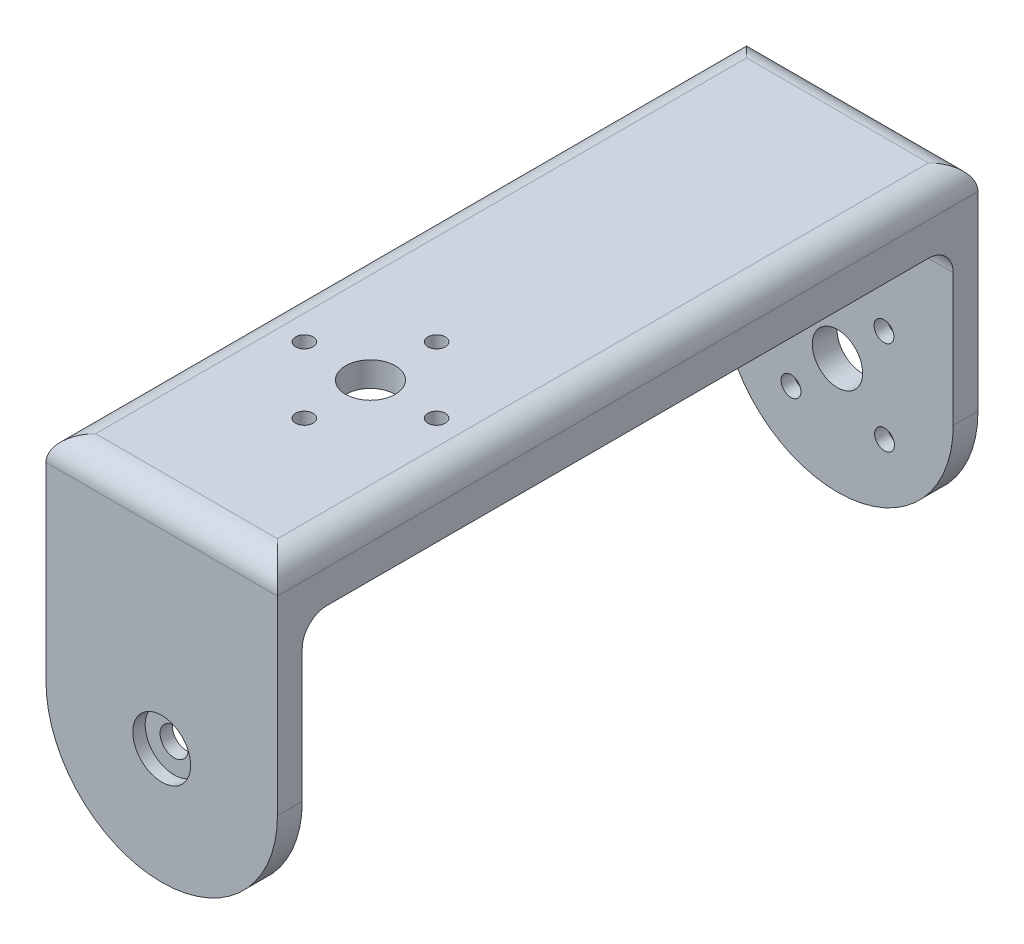
from build123d import *

# Parameters (mm, degrees)
ESBO_O1_R                                            = 3.05
RESSALTO_EXTRUS_O1_DEPTH                             = 3
REBAIXO_PARA_PARAFUSO_COM_CABE_A_REDONDA_D           = 2.4
REBAIXO_PARA_PARAFUSO_COM_CABE_A_REDONDA_CBORE_D     = 4.4
REBAIXO_PARA_PARAFUSO_COM_CABE_A_REDONDA_CBORE_DEPTH = 1.4
PADR_OCIRCULAR1_COUNT                                = 4
SKETCH6_W                                            = 28
SKETCH6_H                                            = 3
BOSS_EXTRUDE2_DEPTH                                  = 78.75
SKETCH8_W                                            = 28
SKETCH8_H                                            = 3
BOSS_EXTRUDE3_DEPTH                                  = 3
SKETCH10_R                                           = 3.05
BOSS_EXTRUDE4_DEPTH                                  = 3
SKETCH12_R                                           = 3.5
CUT_EXTRUDE3_DEPTH                                   = 1.5
SKETCH13_R                                           = 1.7
CUT_EXTRUDE4_DEPTH                                   = 1.5
SKETCH15_R                                           = 1.05
SKETCH15_R_2                                         = 3
CUT_EXTRUDE5_DEPTH                                   = 3
ESBO_O12_W                                           = 84.75
ESBO_O12_H                                           = 7
RESSALTO_EXTRUS_O2_DEPTH                             = 3
ESBO_O13_W                                           = 84.75
ESBO_O13_H                                           = 7
RESSALTO_EXTRUS_O3_DEPTH                             = 3
FILLET2_R                                            = 3


with BuildPart() as part:
    # Esboço1 → Ressalto-extrusão1 (new body)
    with BuildSketch(Plane.XY):
        with BuildLine():
            Line((16.663507, 58.105442), (-7.336493, 58.105442))
            Line((-7.336493, 58.105442), (-9.336493, 58.105442))
            Line((-9.336493, 58.105442), (-9.336493, 32.105442))
            ThreePointArc((-9.336493, 32.105442), (4.663507, 18.105442), (18.663507, 32.105442))
            Line((18.663507, 32.105442), (18.663507, 58.105442))
            Line((18.663507, 58.105442), (16.663507, 58.105442))
        make_face()
        with Locations((4.663507, 32.105442)):
            Circle(ESBO_O1_R, mode=Mode.SUBTRACT)
    ressalto_extrus_o1 = extrude(amount=-RESSALTO_EXTRUS_O1_DEPTH)

    # Rebaixo para parafuso com cabeça redonda de M21 (through all)
    with Locations(Plane(origin=(0, 0, -3), x_dir=(-1, 0, 0), z_dir=(0, 0, -1))):
        with Locations((-10.288249, 37.794227)):
            rebaixo_para_parafuso_com_cabe_a_redonda = CounterBoreHole(REBAIXO_PARA_PARAFUSO_COM_CABE_A_REDONDA_D / 2, REBAIXO_PARA_PARAFUSO_COM_CABE_A_REDONDA_CBORE_D / 2, REBAIXO_PARA_PARAFUSO_COM_CABE_A_REDONDA_CBORE_DEPTH)

    # PadrãoCircular1: Rebaixo para parafuso com cabeça redonda de M21 ×4 about axis
    padr_ocircular1_axis = Axis((4.663507, 32.105442, 0), (0, 0, 1))
    for i in range(1, PADR_OCIRCULAR1_COUNT):
        add(rebaixo_para_parafuso_com_cabe_a_redonda.rotate(padr_ocircular1_axis, i * 360 / PADR_OCIRCULAR1_COUNT), mode=Mode.SUBTRACT)

    # Sketch6 → Boss-Extrude2 (add)
    with BuildSketch(Plane.XY):
        with Locations((4.663507, 56.605442)):
            Rectangle(SKETCH6_W, SKETCH6_H)
    extrude(amount=BOSS_EXTRUDE2_DEPTH)

    # Sketch8 → Boss-Extrude3 (add)
    with BuildSketch(Plane.XY.offset(78.75)):
        with Locations((4.663507, 56.605442)):
            Rectangle(SKETCH8_W, SKETCH8_H)
    extrude(amount=BOSS_EXTRUDE3_DEPTH)

    # Mirror1: Ressalto-extrusão1 across plane
    add(ressalto_extrus_o1.mirror(Plane(origin=(0, 0, 39.375), x_dir=(1, 0, 0), z_dir=(0, 0, -1))))

    # Sketch10 → Boss-Extrude4 (add)
    with BuildSketch(Plane.XY.offset(81.75)):
        with Locations((4.663507, 32.105442)):
            Circle(SKETCH10_R)
    extrude(amount=-BOSS_EXTRUDE4_DEPTH)

    # Sketch12 → Cut-Extrude3 (cut)
    with BuildSketch(Plane.XY.offset(81.75)):
        with Locations((4.663507, 32.105442)):
            Circle(SKETCH12_R)
    extrude(amount=-CUT_EXTRUDE3_DEPTH, mode=Mode.SUBTRACT)

    # Sketch13 → Cut-Extrude4 (cut)
    with BuildSketch(Plane.XY.offset(80.25)):
        with Locations((4.663507, 32.105442)):
            Circle(SKETCH13_R)
    extrude(amount=-CUT_EXTRUDE4_DEPTH, mode=Mode.SUBTRACT)

    # Sketch15 → Cut-Extrude5 (cut)
    with BuildSketch(Plane(origin=(0, 58.105442, 0), x_dir=(1, 0, 0), z_dir=(0, 1, 0))):
        with Locations(Location((4.663507, -64.5, 0), (0, 0, 180))):
            Circle(SKETCH15_R)
        with Locations(Location((-3.336493, -56.5, 0), (0, 0, 180))):
            Circle(SKETCH15_R)
        with Locations(Location((4.663507, -48.5, 0), (0, 0, 180))):
            Circle(SKETCH15_R)
        with Locations(Location((12.663507, -56.5, 0), (0, 0, 180))):
            Circle(SKETCH15_R)
        with Locations(Location((4.663507, -56.5, 0), (0, 0, 180))):
            Circle(SKETCH15_R_2)
    extrude(amount=-CUT_EXTRUDE5_DEPTH, mode=Mode.SUBTRACT)

    # Esboço12 → Ressalto-extrusão2 (add)
    with BuildSketch(Plane.ZY.offset(9.336493)):
        with Locations((39.375, 54.605442)):
            Rectangle(ESBO_O12_W, ESBO_O12_H)
    extrude(amount=-RESSALTO_EXTRUS_O2_DEPTH)

    # Esboço13 → Ressalto-extrusão3 (add)
    with BuildSketch(Plane(origin=(18.663507, 0, 0), x_dir=(0, 0, -1), z_dir=(1, 0, 0))):
        with Locations((-39.375, 54.605442)):
            Rectangle(ESBO_O13_W, ESBO_O13_H)
    extrude(amount=-RESSALTO_EXTRUS_O3_DEPTH)

    # Fillet2
    # the kernel refuses this fillet: 3 mm, written as the material it adds along each edge
    with BuildSketch(Plane(origin=(-3.336493, 52.105442, 75.75), x_dir=(-1, 0, 0), z_dir=(0, 1, 0))) as fillet2_piece_1_section:
        Polygon((0, 0), (FILLET2_R, 0), (FILLET2_R, FILLET2_R), (0, FILLET2_R), align=None)
    fillet2_piece_1 = extrude(amount=FILLET2_R, mode=Mode.PRIVATE)
    fillet2_piece_1 = fillet2_piece_1 - Plane(origin=(-3.336493, 52.105442, 75.75), x_dir=(0.7071067811865477, 0, -0.7071067811865475), z_dir=(0, 1, 0)) * Sphere(FILLET2_R, mode=Mode.PRIVATE)
    add(fillet2_piece_1)
    with BuildSketch(Plane(origin=(-3.336493, 52.105442, 3), x_dir=(-1, 0, 0), z_dir=(0, 1, 0))) as fillet2_piece_2_section:
        Polygon((0, 0), (FILLET2_R, 0), (FILLET2_R, -FILLET2_R), (0, -FILLET2_R), align=None)
    fillet2_piece_2 = extrude(amount=FILLET2_R, mode=Mode.PRIVATE)
    fillet2_piece_2 = fillet2_piece_2 - Plane(origin=(-3.336493, 52.105442, 3), x_dir=(0.7071067811865475, 0, 0.7071067811865475), z_dir=(0, 1, 0)) * Sphere(FILLET2_R, mode=Mode.PRIVATE)
    add(fillet2_piece_2)
    with BuildSketch(Plane(origin=(12.663507, 52.105442, 3), x_dir=(1, 0, 0), z_dir=(0, 1, 0))) as fillet2_piece_3_section:
        Polygon((0, 0), (FILLET2_R, 0), (FILLET2_R, FILLET2_R), (0, FILLET2_R), align=None)
    fillet2_piece_3 = extrude(amount=FILLET2_R, mode=Mode.PRIVATE)
    fillet2_piece_3 = fillet2_piece_3 - Plane(origin=(12.663507, 52.105442, 3), x_dir=(-0.7071067811865475, 0, 0.7071067811865475), z_dir=(0, 1, 0)) * Sphere(FILLET2_R, mode=Mode.PRIVATE)
    add(fillet2_piece_3)
    with BuildSketch(Plane(origin=(12.663507, 52.105442, 75.75), x_dir=(1, 0, 0), z_dir=(0, 1, 0))) as fillet2_piece_4_section:
        Polygon((0, 0), (FILLET2_R, 0), (FILLET2_R, -FILLET2_R), (0, -FILLET2_R), align=None)
    fillet2_piece_4 = extrude(amount=FILLET2_R, mode=Mode.PRIVATE)
    fillet2_piece_4 = fillet2_piece_4 - Plane(origin=(12.663507, 52.105442, 75.75), x_dir=(-0.7071067811865475, 0, -0.7071067811865476), z_dir=(0, 1, 0)) * Sphere(FILLET2_R, mode=Mode.PRIVATE)
    add(fillet2_piece_4)
    with BuildSketch(Plane(origin=(-6.336493, 51.105442, 78.75), x_dir=(0, 0, -1), z_dir=(0, 1, 0))) as fillet2_piece_5:
        with BuildLine():
            CenterArc((FILLET2_R, -FILLET2_R), FILLET2_R, 90, 90)
            Line((0, -FILLET2_R), (0, 0))
            Line((0, 0), (FILLET2_R, 0))
        make_face()
    extrude(amount=1)
    with BuildSketch(Plane(origin=(-6.336493, 51.105442, 78.75), x_dir=(0, 0, -1), z_dir=(-1, 0, 0))) as fillet2_piece_6:
        with BuildLine():
            CenterArc((FILLET2_R, FILLET2_R), FILLET2_R, 180, 90)
            Line((0, FILLET2_R), (0, 0))
            Line((0, 0), (FILLET2_R, 0))
        make_face()
    extrude(amount=3)
    with BuildSketch(Plane(origin=(-3.336493, 55.105442, 0), x_dir=(0, 0, 1), z_dir=(1, 0, 0))) as fillet2_piece_7:
        with BuildLine():
            CenterArc((FILLET2_R, FILLET2_R), FILLET2_R, 180, 90)
            Line((0, FILLET2_R), (0, 0))
            Line((0, 0), (FILLET2_R, 0))
        make_face()
    extrude(amount=16)
    with BuildSketch(Plane(origin=(-6.336493, 51.105442, 0), x_dir=(0, 0, 1), z_dir=(0, 1, 0)), Plane(origin=(15.663507, 52.105442, 78.75), x_dir=(-1, 0, 0), z_dir=(0, -1, 0)), Plane(origin=(15.663507, 52.105442, 0), x_dir=(0, 0, 1), z_dir=(0, -1, 0))) as fillet2_piece_8:
        with BuildLine():
            CenterArc((FILLET2_R, FILLET2_R), FILLET2_R, 180, 90)
            Line((0, FILLET2_R), (0, 0))
            Line((0, 0), (FILLET2_R, 0))
        make_face()
    extrude(amount=1)
    with BuildSketch(Plane(origin=(-6.336493, 51.105442, 0), x_dir=(0, 0, 1), z_dir=(-1, 0, 0)), Plane(origin=(18.663507, 51.105442, 78.75), x_dir=(0, -1, 0), z_dir=(-1, 0, 0)), Plane(origin=(18.663507, 51.105442, 0), x_dir=(0, 0, 1), z_dir=(-1, 0, 0))) as fillet2_piece_9:
        with BuildLine():
            CenterArc((FILLET2_R, -FILLET2_R), FILLET2_R, 90, 90)
            Line((0, -FILLET2_R), (0, 0))
            Line((0, 0), (FILLET2_R, 0))
        make_face()
    extrude(amount=3)
    with BuildSketch(Plane(origin=(-6.336493, 55.105442, 75.75), x_dir=(1, 0, 0), z_dir=(0, 0, -1))) as fillet2_piece_10_section:
        with BuildLine():
            CenterArc((FILLET2_R, FILLET2_R), FILLET2_R, 180, 90)
            Line((0, FILLET2_R), (0, 0))
            Line((0, 0), (FILLET2_R, 0))
        make_face()
    fillet2_piece_10 = extrude(amount=72.75, mode=Mode.PRIVATE)
    fillet2_piece_10 = fillet2_piece_10 - Plane(origin=(-3.336493, 54.425508, 56.5), x_dir=(-1, 0, 0), z_dir=(0, 1, 0)) * Cylinder(1.05, 158, mode=Mode.PRIVATE)
    add(fillet2_piece_10)
    with BuildSketch(Plane(origin=(-3.336493, 55.105442, 78.75), x_dir=(0, 0, -1), z_dir=(1, 0, 0))) as fillet2_piece_11:
        with BuildLine():
            CenterArc((FILLET2_R, -FILLET2_R), FILLET2_R, 90, 90)
            Line((0, -FILLET2_R), (0, 0))
            Line((0, 0), (FILLET2_R, 0))
        make_face()
    extrude(amount=16)
    with BuildSketch(Plane(origin=(15.663507, 55.105442, 3), x_dir=(-1, 0, 0), z_dir=(0, 0, 1))) as fillet2_piece_12_section:
        with BuildLine():
            CenterArc((FILLET2_R, FILLET2_R), FILLET2_R, 180, 90)
            Line((0, FILLET2_R), (0, 0))
            Line((0, 0), (FILLET2_R, 0))
        make_face()
    fillet2_piece_12 = extrude(amount=72.75, mode=Mode.PRIVATE)
    fillet2_piece_12 = fillet2_piece_12 - Plane(origin=(12.663507, 54.425508, 56.5), x_dir=(-1, 0, 0), z_dir=(0, 1, 0)) * Cylinder(1.05, 158, mode=Mode.PRIVATE)
    add(fillet2_piece_12)
    with BuildSketch(Plane(origin=(-6.336493, 43.605442, 78.75), x_dir=(0, 0, -1), z_dir=(0, 1, 0))) as fillet2_piece_13a_section:
        with BuildLine():
            CenterArc((FILLET2_R, -FILLET2_R), FILLET2_R, 90, 90)
            Line((0, -FILLET2_R), (0, 0))
            Line((0, 0), (FILLET2_R, 0))
        make_face()
    fillet2_piece_13a = extrude(amount=8.5, mode=Mode.PRIVATE)
    fillet2_piece_13a = split(fillet2_piece_13a, bisect_by=Plane(origin=(-5.657307, 51.105442, 78.070815), z_dir=(0, -1, 0)), keep=Keep.TOP, mode=Mode.PRIVATE)
    with BuildSketch(Plane(origin=(1.163507, 51.105442, 78.75), x_dir=(0, 0, -1), z_dir=(-1, 0, 0))) as fillet2_piece_13b_section:
        with BuildLine():
            CenterArc((FILLET2_R, FILLET2_R), FILLET2_R, 180, 90)
            Line((0, FILLET2_R), (0, 0))
            Line((0, 0), (FILLET2_R, 0))
        make_face()
    fillet2_piece_13b = extrude(amount=10.5, mode=Mode.PRIVATE)
    fillet2_piece_13b = split(fillet2_piece_13b, bisect_by=Plane(origin=(-6.336493, 50.426256, 78.070815), z_dir=(1, 0, 0)), keep=Keep.TOP, mode=Mode.PRIVATE)
    fillet2_piece_13 = fillet2_piece_13a & fillet2_piece_13b
    add(fillet2_piece_13)
    with BuildSketch(Plane(origin=(-6.336493, 43.605442, 0), x_dir=(0, 0, 1), z_dir=(0, 1, 0))) as fillet2_piece_14a_section:
        with BuildLine():
            CenterArc((FILLET2_R, FILLET2_R), FILLET2_R, 180, 90)
            Line((0, FILLET2_R), (0, 0))
            Line((0, 0), (FILLET2_R, 0))
        make_face()
    fillet2_piece_14a = extrude(amount=8.5, mode=Mode.PRIVATE)
    fillet2_piece_14a = split(fillet2_piece_14a, bisect_by=Plane(origin=(-5.657307, 51.105442, 0.679185), z_dir=(0, -1, 0)), keep=Keep.TOP, mode=Mode.PRIVATE)
    with BuildSketch(Plane(origin=(1.163507, 51.105442, 0), x_dir=(0, 0, 1), z_dir=(-1, 0, 0))) as fillet2_piece_14b_section:
        with BuildLine():
            CenterArc((FILLET2_R, -FILLET2_R), FILLET2_R, 90, 90)
            Line((0, -FILLET2_R), (0, 0))
            Line((0, 0), (FILLET2_R, 0))
        make_face()
    fillet2_piece_14b = extrude(amount=10.5, mode=Mode.PRIVATE)
    fillet2_piece_14b = split(fillet2_piece_14b, bisect_by=Plane(origin=(-6.336493, 50.426256, 0.679185), z_dir=(1, 0, 0)), keep=Keep.TOP, mode=Mode.PRIVATE)
    fillet2_piece_14 = fillet2_piece_14a & fillet2_piece_14b
    add(fillet2_piece_14)
    with BuildSketch(Plane(origin=(15.663507, 52.105442, 78.75), x_dir=(-1, 0, 0), z_dir=(0, -1, 0))) as fillet2_piece_15a_section:
        with BuildLine():
            CenterArc((FILLET2_R, FILLET2_R), FILLET2_R, 180, 90)
            Line((0, FILLET2_R), (0, 0))
            Line((0, 0), (FILLET2_R, 0))
        make_face()
    fillet2_piece_15a = extrude(amount=8.5, mode=Mode.PRIVATE)
    fillet2_piece_15a = split(fillet2_piece_15a, bisect_by=Plane(origin=(14.984322, 51.105442, 78.070815), z_dir=(0, -1, 0)), keep=Keep.TOP, mode=Mode.PRIVATE)
    with BuildSketch(Plane(origin=(18.663507, 51.105442, 78.75), x_dir=(0, -1, 0), z_dir=(-1, 0, 0))) as fillet2_piece_15b_section:
        with BuildLine():
            CenterArc((FILLET2_R, -FILLET2_R), FILLET2_R, 90, 90)
            Line((0, -FILLET2_R), (0, 0))
            Line((0, 0), (FILLET2_R, 0))
        make_face()
    fillet2_piece_15b = extrude(amount=10.5, mode=Mode.PRIVATE)
    fillet2_piece_15b = split(fillet2_piece_15b, bisect_by=Plane(origin=(15.663507, 50.426256, 78.070815), z_dir=(-1, 0, 0)), keep=Keep.TOP, mode=Mode.PRIVATE)
    fillet2_piece_15 = fillet2_piece_15a & fillet2_piece_15b
    add(fillet2_piece_15)
    with BuildSketch(Plane(origin=(18.663507, 51.105442, 0), x_dir=(0, 0, 1), z_dir=(-1, 0, 0))) as fillet2_piece_16a_section:
        with BuildLine():
            CenterArc((FILLET2_R, -FILLET2_R), FILLET2_R, 90, 90)
            Line((0, -FILLET2_R), (0, 0))
            Line((0, 0), (FILLET2_R, 0))
        make_face()
    fillet2_piece_16a = extrude(amount=10.5, mode=Mode.PRIVATE)
    fillet2_piece_16a = split(fillet2_piece_16a, bisect_by=Plane(origin=(15.663507, 50.426256, 0.679185), z_dir=(-1, 0, 0)), keep=Keep.TOP, mode=Mode.PRIVATE)
    with BuildSketch(Plane(origin=(15.663507, 52.105442, 0), x_dir=(0, 0, 1), z_dir=(0, -1, 0))) as fillet2_piece_16b_section:
        with BuildLine():
            CenterArc((FILLET2_R, FILLET2_R), FILLET2_R, 180, 90)
            Line((0, FILLET2_R), (0, 0))
            Line((0, 0), (FILLET2_R, 0))
        make_face()
    fillet2_piece_16b = extrude(amount=8.5, mode=Mode.PRIVATE)
    fillet2_piece_16b = split(fillet2_piece_16b, bisect_by=Plane(origin=(14.984322, 51.105442, 0.679185), z_dir=(0, -1, 0)), keep=Keep.TOP, mode=Mode.PRIVATE)
    fillet2_piece_16 = fillet2_piece_16a & fillet2_piece_16b
    add(fillet2_piece_16)
    # the kernel refuses this fillet: 3 mm, written as the material it takes off along each edge
    with BuildSketch(Plane(origin=(-9.336493, 58.105442, -10.5), x_dir=(1, 0, 0), z_dir=(0, 0, 1)), Plane(origin=(18.663507, 58.105442, 89.25), x_dir=(-1, 0, 0), z_dir=(0, 0, -1))) as fillet2_2_piece_1:
        with BuildLine():
            CenterArc((FILLET2_R, -FILLET2_R), FILLET2_R, 90, 90)
            Line((0, -FILLET2_R), (0, 0))
            Line((0, 0), (FILLET2_R, 0))
        make_face()
    extrude(amount=99.75, mode=Mode.SUBTRACT)
    with BuildSketch(Plane(origin=(26.163507, 58.105442, -3), x_dir=(0, 0, 1), z_dir=(-1, 0, 0)), Plane(origin=(-16.836493, 58.105442, 81.75), x_dir=(0, 0, -1), z_dir=(1, 0, 0))) as fillet2_2_piece_2:
        with BuildLine():
            CenterArc((FILLET2_R, -FILLET2_R), FILLET2_R, 90, 90)
            Line((0, -FILLET2_R), (0, 0))
            Line((0, 0), (FILLET2_R, 0))
        make_face()
    extrude(amount=43, mode=Mode.SUBTRACT)


solid = part.part
